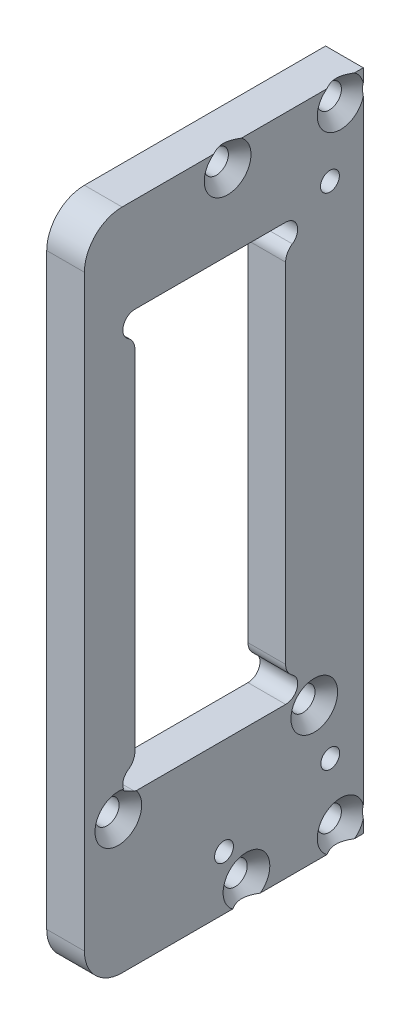
from build123d import *

# Parameters (mm, degrees)
SKETCH1_W           = 88
SKETCH1_H           = 37
SKETCH1_R           = 1.6
BOSS_EXTRUDE1_DEPTH = 5
FILLET1_R           = 5
CHAMFER2_SIZE       = 1.5
SKETCH2_R           = 1.25
CUT_EXTRUDE1_DEPTH  = 10


with BuildPart() as part:
    # Sketch1 → Boss-Extrude1 (new body)
    with BuildSketch(Plane.YZ):
        Rectangle(SKETCH1_W, SKETCH1_H)
        with Locations(Location((-41.5, -15.5, 0), (0, 0, 270))):
            Circle(SKETCH1_R, mode=Mode.SUBTRACT)
        with Locations(Location((-41.5, -3, 0), (0, 0, 270))):
            Circle(SKETCH1_R, mode=Mode.SUBTRACT)
        with Locations(Location((41.5, -15.5, 0), (0, 0, 90))):
            Circle(SKETCH1_R, mode=Mode.SUBTRACT)
        with Locations(Location((-26, 14, 0), (0, 0, 270))):
            Circle(SKETCH1_R, mode=Mode.SUBTRACT)
        with Locations(Location((-26, -12, 0), (0, 0, 270))):
            Circle(SKETCH1_R, mode=Mode.SUBTRACT)
        with Locations(Location((41.5, -0.5, 0), (0, 0, 270))):
            Circle(SKETCH1_R, mode=Mode.SUBTRACT)
        with BuildLine():
            Line((-24, -8.2), (-24, 11.8))
            ThreePointArc((-24, 11.8), (-22.86444197, 13.331108636), (-21.069632929, 12.688888889))
            ThreePointArc((-21.069632929, 12.688888889), (-20.349483132, 12.036165793), (-19.406674091, 11.8))
            Line((-19.406674091, 11.8), (26.806674091, 11.8))
            ThreePointArc((26.806674091, 11.8), (27.749483132, 12.036165793), (28.469632929, 12.688888889))
            ThreePointArc((28.469632929, 12.688888889), (30.26444197, 13.331108636), (31.4, 11.8))
            Line((31.4, 11.8), (31.4, -8.2))
            ThreePointArc((31.4, -8.2), (30.26444197, -9.731108636), (28.469632929, -9.088888889))
            ThreePointArc((28.469632929, -9.088888889), (27.749483132, -8.436165793), (26.806674091, -8.2))
            Line((26.806674091, -8.2), (-19.406674091, -8.2))
            ThreePointArc((-19.406674091, -8.2), (-20.349483132, -8.436165793), (-21.069632929, -9.088888889))
            ThreePointArc((-21.069632929, -9.088888889), (-22.86444197, -9.731108636), (-24, -8.2))
        make_face(mode=Mode.SUBTRACT)
    extrude(amount=BOSS_EXTRUDE1_DEPTH)

    # Fillet1
    fillet1_edges = [part.edges().sort_by_distance(p)[0] for p in [
        (2.5, -44, 18.5),
        (2.5, 44, 18.5),
    ]]
    fillet(fillet1_edges, radius=FILLET1_R)

    # Chamfer2
    # the kernel refuses this chamfer: 1.5 mm, written as the material it takes off along each edge
    with BuildSketch(Plane(origin=(5, -41.5, -15.5), x_dir=(0, 0, -1), z_dir=(0, -1, 0))) as chamfer2_piece_1:
        Polygon((1.6 + CHAMFER2_SIZE, 0), (1.6, -CHAMFER2_SIZE), (1.6, 0), align=None)
    revolve(axis=Axis((5, -41.5, -15.5), (1, 0, 0)), mode=Mode.SUBTRACT)
    with BuildSketch(Plane(origin=(5, -41.5, -3), x_dir=(0, 0, -1), z_dir=(0, -1, 0))) as chamfer2_piece_2:
        Polygon((1.6 + CHAMFER2_SIZE, 0), (1.6, -CHAMFER2_SIZE), (1.6, 0), align=None)
    revolve(axis=Axis((5, -41.5, -3), (1, 0, 0)), mode=Mode.SUBTRACT)
    with BuildSketch(Plane(origin=(5, 41.5, -0.5), x_dir=(0, 0, -1), z_dir=(0, -1, 0))) as chamfer2_piece_3:
        Polygon((1.6 + CHAMFER2_SIZE, 0), (1.6, -CHAMFER2_SIZE), (1.6, 0), align=None)
    revolve(axis=Axis((5, 41.5, -0.5), (1, 0, 0)), mode=Mode.SUBTRACT)
    with BuildSketch(Plane(origin=(5, 41.5, -15.5), x_dir=(0, 0, 1), z_dir=(0, 1, 0))) as chamfer2_piece_4:
        Polygon((1.6 + CHAMFER2_SIZE, 0), (1.6, -CHAMFER2_SIZE), (1.6, 0), align=None)
    revolve(axis=Axis((5, 41.5, -15.5), (1, 0, 0)), mode=Mode.SUBTRACT)
    with BuildSketch(Plane(origin=(5, -26, 14), x_dir=(0, 0, -1), z_dir=(0, -1, 0))) as chamfer2_piece_5:
        Polygon((1.6 + CHAMFER2_SIZE, 0), (1.6, -CHAMFER2_SIZE), (1.6, 0), align=None)
    revolve(axis=Axis((5, -26, 14), (1, 0, 0)), mode=Mode.SUBTRACT)
    with BuildSketch(Plane(origin=(5, -26, -12), x_dir=(0, 0, -1), z_dir=(0, -1, 0))) as chamfer2_piece_6:
        Polygon((1.6 + CHAMFER2_SIZE, 0), (1.6, -CHAMFER2_SIZE), (1.6, 0), align=None)
    revolve(axis=Axis((5, -26, -12), (1, 0, 0)), mode=Mode.SUBTRACT)

    # Sketch2 → Cut-Extrude1 (cut)
    with BuildSketch(Plane.YZ.offset(5)):
        with Locations(Location((-36.826603685, -0.023130638, 0), (0, 0, 270))):
            Circle(SKETCH2_R)
        with Locations(Location((-33.167413509, -14.120748425, 0), (0, 0, 270))):
            Circle(SKETCH2_R)
        with Locations(Location((33.182572395, -14.077498807, 0), (0, 0, 270))):
            Circle(SKETCH2_R)
    extrude(amount=-CUT_EXTRUDE1_DEPTH, mode=Mode.SUBTRACT)


solid = part.part
